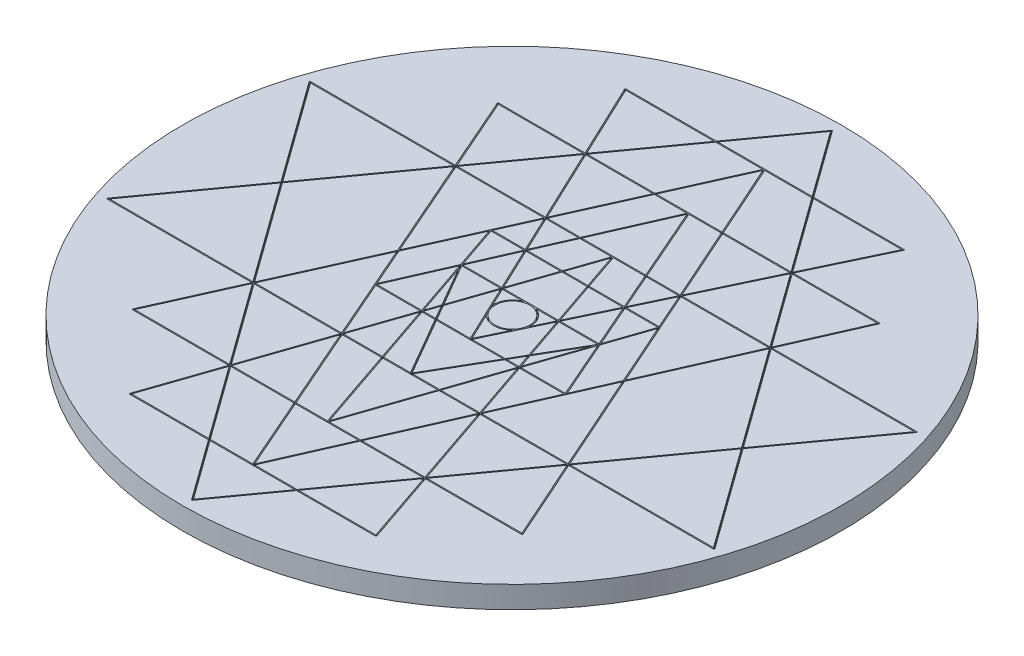
from build123d import *

# Parameters (mm, degrees)
SKETCH1_R           = 135
SKETCH1_R_2         = 7.082134324
BOSS_EXTRUDE3_DEPTH = 9
SKETCH4_R           = 135
BOSS_EXTRUDE4_DEPTH = 8


with BuildPart() as part:
    # Sketch1 → Boss-Extrude3 (new body)
    # profile 1 of 78: a face of its own
    with BuildSketch(Plane(origin=(0, 0, 0), x_dir=(1, 0, 0), z_dir=(0, 1, 0))):
        Circle(SKETCH1_R)
        with BuildLine():
            Line((-94.650912929, 0), (-124.38352904, 41.253827153))
            ThreePointArc((-124.38352904, 41.253827153), (-124.403249594, 41.513922755), (-124.180715089, 41.65))
            Line((-124.180715089, 41.65), (-64.887027362, 41.65))
            Line((-64.887027362, 41.65), (-78.251547748, 72.199247985))
            ThreePointArc((-78.251547748, 72.199247985), (-78.231730987, 72.436287213), (-78.022506278, 72.549447812))
            Line((-78.022506278, 72.549447812), (-42.629642686, 72.549447812))
            Line((-42.629642686, 72.549447812), (-57.169541703, 103.285033746))
            ThreePointArc((-57.169541703, 103.285033746), (-57.154771859, 103.525681685), (-56.943553046, 103.641940842))
            Line((-56.943553046, 103.641940842), (-19.953696869, 103.641940842))
            Line((-19.953696869, 103.641940842), (-0.202813951, 131.046172847))
            ThreePointArc((-0.202813951, 131.046172847), (0, 131.15), (0.202813951, 131.046172847))
            Line((0.202813951, 131.046172847), (19.953696869, 103.641940842))
            Line((19.953696869, 103.641940842), (56.943553046, 103.641940842))
            ThreePointArc((56.943553046, 103.641940842), (57.154771859, 103.525681685), (57.169541703, 103.285033746))
            Line((57.169541703, 103.285033746), (42.629642686, 72.549447812))
            Line((42.629642686, 72.549447812), (78.022506278, 72.549447812))
            ThreePointArc((78.022506278, 72.549447812), (78.231730987, 72.436287213), (78.251547748, 72.199247985))
            Line((78.251547748, 72.199247985), (64.887027362, 41.65))
            Line((64.887027362, 41.65), (124.180715089, 41.65))
            ThreePointArc((124.180715089, 41.65), (124.403249594, 41.513922755), (124.38352904, 41.253827153))
            Line((124.38352904, 41.253827153), (94.650912929, 0))
            Line((94.650912929, 0), (124.38352904, -41.253827153))
            ThreePointArc((124.38352904, -41.253827153), (124.403249594, -41.513922755), (124.180715089, -41.65))
            Line((124.180715089, -41.65), (64.889843958, -41.65))
            Line((64.889843958, -41.65), (79.924154275, -75.397063248))
            ThreePointArc((79.924154275, -75.397063248), (79.905473966, -75.634935118), (79.695790923, -75.748799079))
            Line((79.695790923, -75.748799079), (40.278539032, -75.748799079))
            Line((40.278539032, -75.748799079), (50.600214945, -105.967250897))
            ThreePointArc((50.600214945, -105.967250897), (50.566984629, -106.193486003), (50.363635096, -106.298059158))
            Line((50.363635096, -106.298059158), (18.039369117, -106.298059158))
            Line((18.039369117, -106.298059158), (0.202813951, -131.046172847))
            ThreePointArc((0.202813951, -131.046172847), (0, -131.15), (-0.202813951, -131.046172847))
            Line((-0.202813951, -131.046172847), (-18.039369117, -106.298059158))
            Line((-18.039369117, -106.298059158), (-50.363635096, -106.298059158))
            ThreePointArc((-50.363635096, -106.298059158), (-50.566984629, -106.193486003), (-50.600214945, -105.967250897))
            Line((-50.600214945, -105.967250897), (-40.278539032, -75.748799079))
            Line((-40.278539032, -75.748799079), (-79.695790923, -75.748799079))
            ThreePointArc((-79.695790923, -75.748799079), (-79.905473966, -75.634935118), (-79.924154275, -75.397063248))
            Line((-79.924154275, -75.397063248), (-64.889843958, -41.65))
            Line((-64.889843958, -41.65), (-124.180715089, -41.65))
            ThreePointArc((-124.180715089, -41.65), (-124.403249594, -41.513922755), (-124.38352904, -41.253827153))
            Line((-124.38352904, -41.253827153), (-94.650912929, 0))
        make_face(mode=Mode.SUBTRACT)
    # profile 2 of 78: a face of its own
    with BuildSketch(Plane(origin=(0, 0, 0), x_dir=(1, 0, 0), z_dir=(0, 1, 0))):
        Polygon((-94.342748724, -0.427575992), (-123.692369928, -41.15), (-64.99312752, -41.15), align=None)
    # profile 3 of 78: a face of its own
    with BuildSketch(Plane(origin=(0, 0, 0), x_dir=(1, 0, 0), z_dir=(0, 1, 0))):
        Polygon((-64.558188122, 40.898323831), (-94.034584519, 0), (-64.556200791, -40.90108124), (-46.501999473, -0.37535968), align=None)
    # profile 4 of 78: a face of its own
    with BuildSketch(Plane(origin=(0, 0, 0), x_dir=(1, 0, 0), z_dir=(0, 1, 0))):
        Polygon((-123.692369928, 41.15), (-94.342748724, 0.427575992), (-64.99312752, 41.15), align=None)
    # profile 5 of 78: a face of its own
    with BuildSketch(Plane(origin=(0, 0, 0), x_dir=(1, 0, 0), z_dir=(0, 1, 0))):
        Polygon((-40.417310612, -75.248799079), (-64.453363927, -41.89891876), (-79.310729324, -75.248799079), align=None)
    # profile 6 of 78: a face of its own
    with BuildSketch(Plane(origin=(0, 0, 0), x_dir=(1, 0, 0), z_dir=(0, 1, 0))):
        Polygon((-50.014061514, -105.798059158), (-18.399731029, -105.798059158), (-39.848815576, -76.037582544), align=None)
    # profile 7 of 78: a face of its own
    with BuildSketch(Plane(origin=(0, 0, 0), x_dir=(1, 0, 0), z_dir=(0, 1, 0))):
        Polygon((17.423040707, -106.298059158), (-17.423040707, -106.298059158), (0, -130.472424008), align=None)
    # profile 8 of 78: a face of its own
    with BuildSketch(Plane(origin=(0, 0, 0), x_dir=(1, 0, 0), z_dir=(0, 1, 0))):
        Polygon((-28.631458129, -41.65), (-64.016437198, -41.65), (-40.009115326, -74.960015614), align=None)
    # profile 9 of 78: a face of its own
    with BuildSketch(Plane(origin=(0, 0, 0), x_dir=(1, 0, 0), z_dir=(0, 1, 0))):
        Polygon((-46.230800318, -0.995279439), (-64.11972076, -41.15), (-28.66412955, -41.15), align=None)
    # profile 10 of 78: a face of its own
    with BuildSketch(Plane(origin=(0, 0, 0), x_dir=(1, 0, 0), z_dir=(0, 1, 0))):
        Polygon((-39.44062029, -75.748799079), (-17.78340262, -105.798059158), (-0.382245002, -105.798059158), (-13.528033374, -75.748799079), align=None)
    # profile 11 of 78: a face of its own
    with BuildSketch(Plane(origin=(0, 0, 0), x_dir=(1, 0, 0), z_dir=(0, 1, 0))):
        Polygon((-64.122537357, 41.15), (-46.226642998, 0.242724701), (-28.002459562, 41.15), align=None)
    # profile 12 of 78: a face of its own
    with BuildSketch(Plane(origin=(0, 0, 0), x_dir=(1, 0, 0), z_dir=(0, 1, 0))):
        Polygon((39.848815576, -76.037582544), (18.399731029, -105.798059158), (50.014061514, -105.798059158), align=None)
    # profile 13 of 78: a face of its own
    with BuildSketch(Plane(origin=(0, 0, 0), x_dir=(1, 0, 0), z_dir=(0, 1, 0))):
        Polygon((-34.57048907, 25.178269787), (-45.955443842, -0.377195058), (-38.965357754, -16.355461929), (-28.549732773, 7.509480006), align=None)
    # profile 14 of 78: a face of its own
    with BuildSketch(Plane(origin=(0, 0, 0), x_dir=(1, 0, 0), z_dir=(0, 1, 0))):
        Polygon((-42.279666185, 71.809639867), (-64.016437198, 41.65), (-28.012226515, 41.65), align=None)
    # profile 15 of 78: a face of its own
    with BuildSketch(Plane(origin=(0, 0, 0), x_dir=(1, 0, 0), z_dir=(0, 1, 0))):
        Polygon((-77.640261276, 72.049447812), (-64.451376596, 41.901676169), (-42.723159295, 72.049447812), align=None)
    # profile 16 of 78: a face of its own
    with BuildSketch(Plane(origin=(0, 0, 0), x_dir=(1, 0, 0), z_dir=(0, 1, 0))):
        Polygon((-42.189962082, 72.789255758), (-20.314058782, 103.141940842), (-56.548724494, 103.141940842), align=None)
    # profile 17 of 78: a face of its own
    with BuildSketch(Plane(origin=(0, 0, 0), x_dir=(1, 0, 0), z_dir=(0, 1, 0))):
        Polygon((0, 130.472424008), (-19.33736846, 103.641940842), (19.33736846, 103.641940842), align=None)
    # profile 18 of 78: a face of its own
    with BuildSketch(Plane(origin=(0, 0, 0), x_dir=(1, 0, 0), z_dir=(0, 1, 0))):
        Polygon((0.382245002, -105.798059158), (17.78340262, -105.798059158), (39.44062029, -75.748799079), (13.528033374, -75.748799079), align=None)
    # profile 19 of 78: a face of its own
    with BuildSketch(Plane(origin=(0, 0, 0), x_dir=(1, 0, 0), z_dir=(0, 1, 0))):
        Polygon((-38.582841649, -17.229835196), (-28.310594963, -40.710618817), (-20.290295308, -17.229835196), align=None)
    # profile 20 of 78: a face of its own
    with BuildSketch(Plane(origin=(0, 0, 0), x_dir=(1, 0, 0), z_dir=(0, 1, 0))):
        Polygon((-13.746770679, -75.248799079), (-28.253174133, -42.089381183), (-39.579391869, -75.248799079), align=None)
    # profile 21 of 78: a face of its own
    with BuildSketch(Plane(origin=(0, 0, 0), x_dir=(1, 0, 0), z_dir=(0, 1, 0))):
        Polygon((79.310729324, -75.248799079), (64.453363927, -41.89891876), (40.417310612, -75.248799079), align=None)
    # profile 22 of 78: a face of its own
    with BuildSketch(Plane(origin=(0, 0, 0), x_dir=(1, 0, 0), z_dir=(0, 1, 0))):
        Polygon((94.342748724, -0.427575992), (64.99312752, -41.15), (123.692369928, -41.15), align=None)
    # profile 23 of 78: a face of its own
    with BuildSketch(Plane(origin=(0, 0, 0), x_dir=(1, 0, 0), z_dir=(0, 1, 0))):
        Polygon((-11.798316719, -41.65), (-27.899639545, -41.65), (-13.20101798, -75.248799079), (-0.349305009, -75.248799079), align=None)
    # profile 24 of 78: a face of its own
    with BuildSketch(Plane(origin=(0, 0, 0), x_dir=(1, 0, 0), z_dir=(0, 1, 0))):
        Polygon((-19.94100333, -17.754095418), (-27.932310966, -41.15), (-11.968695007, -41.15), align=None)
    # profile 25 of 78: a face of its own
    with BuildSketch(Plane(origin=(0, 0, 0), x_dir=(1, 0, 0), z_dir=(0, 1, 0))):
        Polygon((-0.385061599, 103.141940842), (-19.697730373, 103.141940842), (-41.746468973, 72.549447812), (-14.014011478, 72.549447812), align=None)
    # profile 26 of 78: a face of its own
    with BuildSketch(Plane(origin=(0, 0, 0), x_dir=(1, 0, 0), z_dir=(0, 1, 0))):
        Polygon((12.982280674, -75.748799079), (-12.982280674, -75.748799079), (0, -105.42430559), align=None)
    # profile 27 of 78: a face of its own
    with BuildSketch(Plane(origin=(0, 0, 0), x_dir=(1, 0, 0), z_dir=(0, 1, 0))):
        Polygon((-27.610580002, 40.800967905), (-34.154390465, 26.112273784), (-20.661887706, 26.112273784), align=None)
    # profile 28 of 78: a face of its own
    with BuildSketch(Plane(origin=(0, 0, 0), x_dir=(1, 0, 0), z_dir=(0, 1, 0))):
        Polygon((56.548724494, 103.141940842), (20.314058782, 103.141940842), (42.189962082, 72.789255758), align=None)
    # profile 29 of 78: a face of its own
    with BuildSketch(Plane(origin=(0, 0, 0), x_dir=(1, 0, 0), z_dir=(0, 1, 0))):
        Polygon((28.253174133, -42.089381183), (13.746770679, -75.248799079), (39.579391869, -75.248799079), align=None)
    # profile 30 of 78: a face of its own
    with BuildSketch(Plane(origin=(0, 0, 0), x_dir=(1, 0, 0), z_dir=(0, 1, 0))):
        Polygon((40.009115326, -74.960015614), (64.016437198, -41.65), (28.631458129, -41.65), align=None)
    # profile 31 of 78: a face of its own
    with BuildSketch(Plane(origin=(0, 0, 0), x_dir=(1, 0, 0), z_dir=(0, 1, 0))):
        Polygon((46.501999473, -0.37535968), (64.556200791, -40.90108124), (94.034584519, 0), (64.558188122, 40.898323831), align=None)
    # profile 32 of 78: a face of its own
    with BuildSketch(Plane(origin=(0, 0, 0), x_dir=(1, 0, 0), z_dir=(0, 1, 0))):
        Polygon((64.99312752, 41.15), (94.342748724, 0.427575992), (123.692369928, 41.15), align=None)
    # profile 33 of 78: a face of its own
    with BuildSketch(Plane(origin=(0, 0, 0), x_dir=(1, 0, 0), z_dir=(0, 1, 0))):
        Polygon((-20.290026735, -16.729835196), (-28.310542102, 6.807540005), (-38.583203725, -16.729835196), align=None)
    # profile 34 of 78: a face of its own
    with BuildSketch(Plane(origin=(0, 0, 0), x_dir=(1, 0, 0), z_dir=(0, 1, 0))):
        Polygon((-34.190147055, 25.612273784), (-28.253100546, 8.189142616), (-20.64894208, 25.612273784), align=None)
    # profile 35 of 78: a face of its own
    with BuildSketch(Plane(origin=(0, 0, 0), x_dir=(1, 0, 0), z_dir=(0, 1, 0))):
        Polygon((-14.236761384, 72.049447812), (-41.839985581, 72.049447812), (-27.624215923, 41.999032095), align=None)
    # profile 36 of 78: a face of its own
    with BuildSketch(Plane(origin=(0, 0, 0), x_dir=(1, 0, 0), z_dir=(0, 1, 0))):
        Polygon((41.746468973, 72.549447812), (19.697730373, 103.141940842), (0.385061599, 103.141940842), (14.014011478, 72.549447812), align=None)
    # profile 37 of 78: a face of its own
    with BuildSketch(Plane(origin=(0, 0, 0), x_dir=(1, 0, 0), z_dir=(0, 1, 0))):
        Polygon((28.66412955, -41.15), (64.11972076, -41.15), (46.230800318, -0.995279439), align=None)
    # profile 38 of 78: a face of its own
    with BuildSketch(Plane(origin=(0, 0, 0), x_dir=(1, 0, 0), z_dir=(0, 1, 0))):
        Polygon((-19.591416717, -17.229835196), (-11.440463277, -41.15), (-0.433398927, -41.15), (-14.268343199, -17.229835196), align=None)
    # profile 39 of 78: a face of its own
    with BuildSketch(Plane(origin=(0, 0, 0), x_dir=(1, 0, 0), z_dir=(0, 1, 0))):
        Polygon((11.270084989, -41.65), (-11.270084989, -41.65), (0, -74.72371245), align=None)
    # profile 40 of 78: a face of its own
    with BuildSketch(Plane(origin=(0, 0, 0), x_dir=(1, 0, 0), z_dir=(0, 1, 0))):
        Polygon((-13.86765052, 41.15), (-27.22256941, 41.15), (-20.276224505, 26.46626798), align=None)
    # profile 41 of 78: a face of its own
    with BuildSketch(Plane(origin=(0, 0, 0), x_dir=(1, 0, 0), z_dir=(0, 1, 0))):
        Polygon((-13.689388092, 72.049447812), (-27.232336364, 41.65), (-13.649430316, 41.65), (-0.381882927, 72.049447812), align=None)
    # profile 42 of 78: a face of its own
    with BuildSketch(Plane(origin=(0, 0, 0), x_dir=(1, 0, 0), z_dir=(0, 1, 0))):
        Polygon((42.723159295, 72.049447812), (64.451376596, 41.901676169), (77.640261276, 72.049447812), align=None)
    # profile 43 of 78: a face of its own
    with BuildSketch(Plane(origin=(0, 0, 0), x_dir=(1, 0, 0), z_dir=(0, 1, 0))):
        Polygon((0.349305009, -75.248799079), (13.20101798, -75.248799079), (27.899639545, -41.65), (11.798316719, -41.65), align=None)
    # profile 44 of 78: a face of its own
    with BuildSketch(Plane(origin=(0, 0, 0), x_dir=(1, 0, 0), z_dir=(0, 1, 0))):
        Polygon((-17.722212167, -11.25820905), (-19.591148145, -16.729835196), (-14.557533185, -16.729835196), align=None)
    # profile 45 of 78: a face of its own
    with BuildSketch(Plane(origin=(0, 0, 0), x_dir=(1, 0, 0), z_dir=(0, 1, 0))):
        Polygon((0, 102.777604677), (-13.466638187, 72.549447812), (13.466638187, 72.549447812), align=None)
    # profile 46 of 78: a face of its own
    with BuildSketch(Plane(origin=(0, 0, 0), x_dir=(1, 0, 0), z_dir=(0, 1, 0))):
        Polygon((28.002459562, 41.15), (46.226642998, 0.242724701), (64.122537357, 41.15), align=None)
    # profile 47 of 78: a face of its own
    with BuildSketch(Plane(origin=(0, 0, 0), x_dir=(1, 0, 0), z_dir=(0, 1, 0))):
        Polygon((-27.22480771, 5.171466918), (-19.940440123, -16.205574975), (-18.054398633, -10.683869549), align=None)
    # profile 48 of 78: a face of its own
    with BuildSketch(Plane(origin=(0, 0, 0), x_dir=(1, 0, 0), z_dir=(0, 1, 0))):
        Polygon((-11.974572478, 7.74834131), (-20.257893801, 25.258279588), (-27.899938397, 7.74834131), align=None)
    # profile 49 of 78: a face of its own
    with BuildSketch(Plane(origin=(0, 0, 0), x_dir=(1, 0, 0), z_dir=(0, 1, 0))):
        Polygon((28.012226515, 41.65), (64.016437198, 41.65), (42.279666185, 71.809639867), align=None)
    # profile 50 of 78: a face of its own
    with BuildSketch(Plane(origin=(0, 0, 0), x_dir=(1, 0, 0), z_dir=(0, 1, 0))):
        Polygon((41.839985581, 72.049447812), (14.236761384, 72.049447812), (27.624215923, 41.999032095), align=None)
    # profile 51 of 78: a face of its own
    with BuildSketch(Plane(origin=(0, 0, 0), x_dir=(1, 0, 0), z_dir=(0, 1, 0))):
        Polygon((38.965357754, -16.355461929), (45.955443842, -0.377195058), (34.57048907, 25.178269787), (28.549732773, 7.509480006), align=None)
    # profile 52 of 78: a face of its own
    with BuildSketch(Plane(origin=(0, 0, 0), x_dir=(1, 0, 0), z_dir=(0, 1, 0))):
        Polygon((-0.349573581, 41.15), (-13.322104869, 41.15), (-19.885176226, 26.112273784), (-5.485989484, 26.112273784), align=None)
    # profile 53 of 78: a face of its own
    with BuildSketch(Plane(origin=(0, 0, 0), x_dir=(1, 0, 0), z_dir=(0, 1, 0))):
        Polygon((0, 71.674453378), (-13.103884665, 41.65), (13.103884665, 41.65), align=None)
    # profile 54 of 78: a face of its own
    with BuildSketch(Plane(origin=(0, 0, 0), x_dir=(1, 0, 0), z_dir=(0, 1, 0))):
        Polygon((20.290295308, -17.229835196), (28.310594963, -40.710618817), (38.582841649, -17.229835196), align=None)
    # profile 55 of 78: a face of its own
    with BuildSketch(Plane(origin=(0, 0, 0), x_dir=(1, 0, 0), z_dir=(0, 1, 0))):
        Polygon((13.690735332, -17.229835196), (-13.690735332, -17.229835196), (0, -40.900667473), align=None)
    # profile 56 of 78: a face of its own
    with BuildSketch(Plane(origin=(0, 0, 0), x_dir=(1, 0, 0), z_dir=(0, 1, 0))):
        Polygon((0.433398927, -41.15), (11.440463277, -41.15), (19.591416717, -17.229835196), (14.268343199, -17.229835196), align=None)
    # profile 57 of 78: a face of its own
    with BuildSketch(Plane(origin=(0, 0, 0), x_dir=(1, 0, 0), z_dir=(0, 1, 0))):
        Polygon((-17.50775156, -10.630339352), (-13.979925318, -16.729835196), (-0.394828552, -16.729835196), (-11.542291931, 6.834552578), align=None)
    # profile 58 of 78: a face of its own
    with BuildSketch(Plane(origin=(0, 0, 0), x_dir=(1, 0, 0), z_dir=(0, 1, 0))):
        Polygon((-11.929317507, 7.24834131), (-27.848422397, 7.24834131), (-17.839938025, -10.05599985), align=None)
    # profile 59 of 78: a face of its own
    with BuildSketch(Plane(origin=(0, 0, 0), x_dir=(1, 0, 0), z_dir=(0, 1, 0))):
        Polygon((27.232336364, 41.65), (13.689388092, 72.049447812), (0.381882927, 72.049447812), (13.649430316, 41.65), align=None)
    # profile 60 of 78: a face of its own
    with BuildSketch(Plane(origin=(0, 0, 0), x_dir=(1, 0, 0), z_dir=(0, 1, 0))):
        Polygon((19.94100333, -17.754095418), (11.968695007, -41.15), (27.932310966, -41.15), align=None)
    # profile 61 of 78: a face of its own
    with BuildSketch(Plane(origin=(0, 0, 0), x_dir=(1, 0, 0), z_dir=(0, 1, 0))):
        Polygon((-5.656773811, 25.612273784), (-19.872230601, 25.612273784), (-11.61719592, 8.162130043), align=None)
    # profile 62 of 78: a face of its own
    with BuildSketch(Plane(origin=(0, 0, 0), x_dir=(1, 0, 0), z_dir=(0, 1, 0))):
        Polygon((20.661887706, 26.112273784), (34.154390465, 26.112273784), (27.610580002, 40.800967905), align=None)
    # profile 63 of 78: a face of its own
    with BuildSketch(Plane(origin=(0, 0, 0), x_dir=(1, 0, 0), z_dir=(0, 1, 0))):
        Polygon((38.583203725, -16.729835196), (28.310542102, 6.807540005), (20.290026735, -16.729835196), align=None)
    # profile 64 of 78: a face of its own
    with BuildSketch(Plane(origin=(0, 0, 0), x_dir=(1, 0, 0), z_dir=(0, 1, 0))):
        Polygon((20.64894208, 25.612273784), (28.253100546, 8.189142616), (34.190147055, 25.612273784), align=None)
    # profile 65 of 78: a face of its own
    with BuildSketch(Plane(origin=(0, 0, 0), x_dir=(1, 0, 0), z_dir=(0, 1, 0))):
        Polygon((0.394828552, -16.729835196), (13.979925318, -16.729835196), (17.50775156, -10.630339352), (11.542291931, 6.834552578), align=None)
    # profile 66 of 78: a face of its own
    with BuildSketch(Plane(origin=(0, 0, 0), x_dir=(1, 0, 0), z_dir=(0, 1, 0))):
        Polygon((17.722212167, -11.25820905), (14.557533185, -16.729835196), (19.591148145, -16.729835196), align=None)
    # profile 67 of 78: a face of its own
    with BuildSketch(Plane(origin=(0, 0, 0), x_dir=(1, 0, 0), z_dir=(0, 1, 0))):
        Polygon((0, 40.626564221), (-4.957626648, 26.112273784), (4.957626648, 26.112273784), align=None)
    # profile 68 of 78: a face of its own
    with BuildSketch(Plane(origin=(0, 0, 0), x_dir=(1, 0, 0), z_dir=(0, 1, 0))):
        Polygon((19.885176226, 26.112273784), (13.322104869, 41.15), (0.349573581, 41.15), (5.485989484, 26.112273784), align=None)
    # profile 69 of 78: a face of its own
    with BuildSketch(Plane(origin=(0, 0, 0), x_dir=(1, 0, 0), z_dir=(0, 1, 0))):
        with BuildLine():
            Line((-5.243999611, -5.310035244), (0, -16.395215445))
            Line((0, -16.395215445), (5.243999611, -5.310035244))
            ThreePointArc((5.243999611, -5.310035244), (0, -7.415927337), (-5.243999611, -5.310035244))
        make_face()
    # profile 70 of 78: a face of its own
    with BuildSketch(Plane(origin=(0, 0, 0), x_dir=(1, 0, 0), z_dir=(0, 1, 0))):
        with BuildLine():
            Line((-11.184915373, 7.24834131), (-7.559856546, -0.414594104))
            ThreePointArc((-7.559856546, -0.414594104), (-6.405957651, 4.222371119), (-2.707791411, 7.24834131))
            Line((-2.707791411, 7.24834131), (-11.184915373, 7.24834131))
        make_face()
    # profile 71 of 78: a face of its own
    with BuildSketch(Plane(origin=(0, 0, 0), x_dir=(1, 0, 0), z_dir=(0, 1, 0))):
        Polygon((5.128410975, 25.612273784), (-5.128410975, 25.612273784), (-11.230170344, 7.74834131), (11.230170344, 7.74834131), align=None)
    # profile 72 of 78: a face of its own
    with BuildSketch(Plane(origin=(0, 0, 0), x_dir=(1, 0, 0), z_dir=(0, 1, 0))):
        Polygon((20.276224505, 26.46626798), (27.22256941, 41.15), (13.86765052, 41.15), align=None)
    # profile 73 of 78: a face of its own
    with BuildSketch(Plane(origin=(0, 0, 0), x_dir=(1, 0, 0), z_dir=(0, 1, 0))):
        Polygon((18.054398633, -10.683869549), (19.940440123, -16.205574975), (27.22480771, 5.171466918), align=None)
    # profile 74 of 78: a face of its own
    with BuildSketch(Plane(origin=(0, 0, 0), x_dir=(1, 0, 0), z_dir=(0, 1, 0))):
        Polygon((27.899938397, 7.74834131), (20.257893801, 25.258279588), (11.974572478, 7.74834131), align=None)
    # profile 75 of 78: a face of its own
    with BuildSketch(Plane(origin=(0, 0, 0), x_dir=(1, 0, 0), z_dir=(0, 1, 0))):
        Polygon((11.929317507, 7.24834131), (17.839938025, -10.05599985), (27.848422397, 7.24834131), align=None)
    # profile 76 of 78: a face of its own
    with BuildSketch(Plane(origin=(0, 0, 0), x_dir=(1, 0, 0), z_dir=(0, 1, 0))):
        with Locations((0, 0.166206987)):
            Circle(SKETCH1_R_2)
    # profile 77 of 78: a face of its own
    with BuildSketch(Plane(origin=(0, 0, 0), x_dir=(1, 0, 0), z_dir=(0, 1, 0))):
        Polygon((19.872230601, 25.612273784), (5.656773811, 25.612273784), (11.61719592, 8.162130043), align=None)
    # profile 78 of 78: a face of its own
    with BuildSketch(Plane(origin=(0, 0, 0), x_dir=(1, 0, 0), z_dir=(0, 1, 0))):
        with BuildLine():
            ThreePointArc((2.707791411, 7.24834131), (6.405957651, 4.222371119), (7.559856546, -0.414594104))
            Line((7.559856546, -0.414594104), (11.184915373, 7.24834131))
            Line((11.184915373, 7.24834131), (2.707791411, 7.24834131))
        make_face()
    extrude(amount=BOSS_EXTRUDE3_DEPTH)

    # Sketch4 → Boss-Extrude4 (add)
    with BuildSketch(Plane.XZ):
        Circle(SKETCH4_R)
    extrude(amount=-BOSS_EXTRUDE4_DEPTH)


solid = part.part
